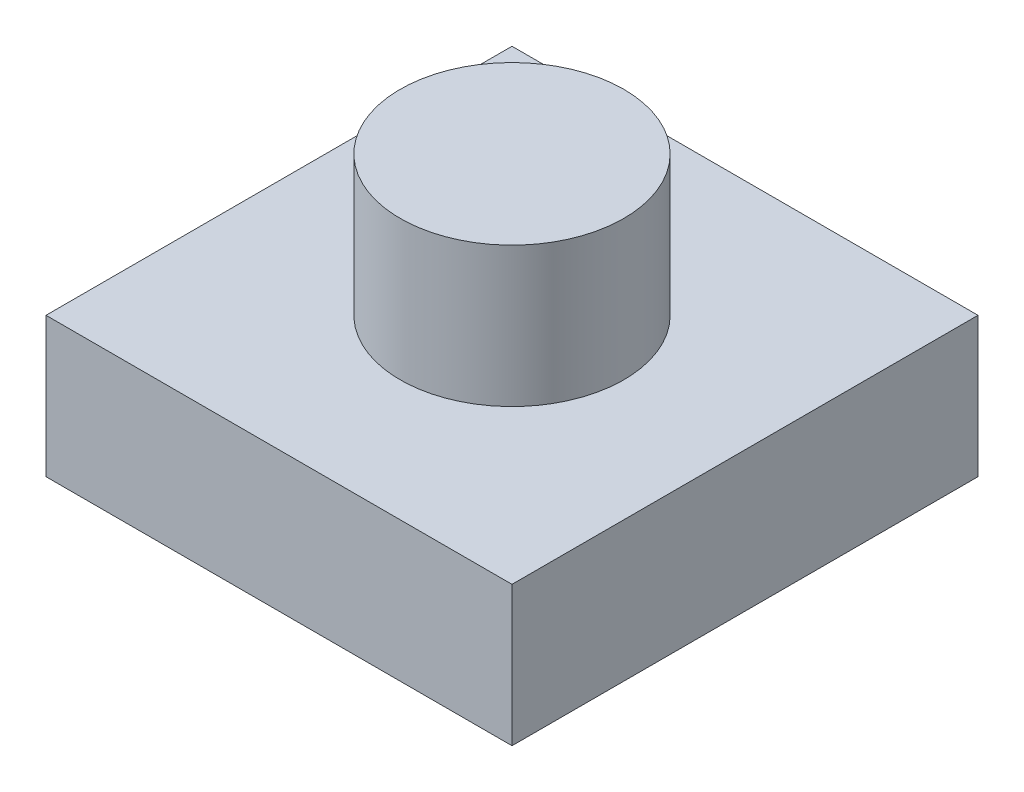
from build123d import *

# Parameters (mm, degrees)
SKETCH1_W           = 12.7
SKETCH1_H           = 12.7
BOSS_EXTRUDE1_DEPTH = 3.81
SKETCH2_R           = 3.048
BOSS_EXTRUDE2_DEPTH = 3.81


with BuildPart() as part:
    # Sketch1 → Boss-Extrude1 (new body)
    with BuildSketch(Plane(origin=(0, 0, 0), x_dir=(1, 0, 0), z_dir=(0, 1, 0))):
        Rectangle(SKETCH1_W, SKETCH1_H)
    extrude(amount=BOSS_EXTRUDE1_DEPTH)

    # Sketch2 → Boss-Extrude2 (add)
    with BuildSketch(Plane(origin=(0, 3.81, 0), x_dir=(1, 0, 0), z_dir=(0, 1, 0))):
        Circle(SKETCH2_R)
    extrude(amount=BOSS_EXTRUDE2_DEPTH)


solid = part.part
